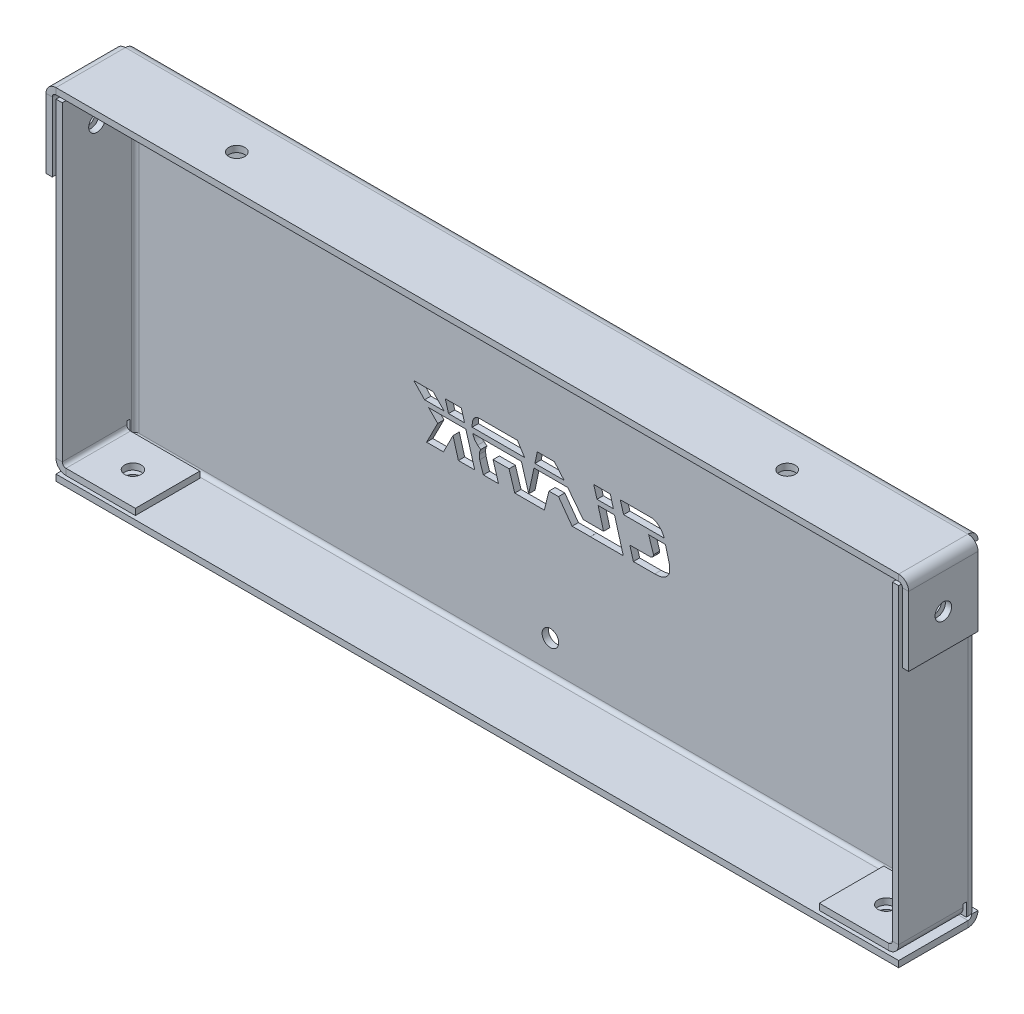
from build123d import *

# Parameters (mm, degrees)
SKETCH1_W                        = 173
SKETCH1_H                        = 70
BASE_FLANGE1_DEPTH               = 1.29
EDGE_FLANGE1_STRIP_W             = 6.684
EDGE_FLANGE1_STRIP_H             = 1.29
EDGE_FLANGE1_STRIP_CUT_DEPTH     = 173
EDGE_FLANGE1_DEPTH               = 173
EDGE_FLANGE2_STRIP_W             = 6.684
EDGE_FLANGE2_STRIP_H             = 1.29
EDGE_FLANGE2_STRIP_CUT_DEPTH     = 173
EDGE_FLANGE2_DEPTH               = 173
EDGE_FLANGE3_STRIP_W             = 6.684
EDGE_FLANGE3_STRIP_H             = 1.29
EDGE_FLANGE3_STRIP_CUT_DEPTH     = 65.896
EDGE_FLANGE3_DEPTH               = 65.896
EDGE_FLANGE4_STRIP_W             = 6.684
EDGE_FLANGE4_STRIP_H             = 1.29
EDGE_FLANGE4_STRIP_CUT_DEPTH     = 65.896
EDGE_FLANGE4_DEPTH               = 65.896
EDGE_FLANGE6_START               = 1.117
EDGE_FLANGE6_DEPTH               = 13.883
EDGE_FLANGE6_2_DEPTH             = 0.645
EDGE_FLANGE6_START_2             = 1.762
EDGE_FLANGE6_3_DEPTH             = 13.238
EDGE_FLANGE8_START               = 1.117
EDGE_FLANGE8_DEPTH               = 13.883
EDGE_FLANGE8_2_DEPTH             = 0.645
EDGE_FLANGE8_START_2             = 1.762
EDGE_FLANGE8_3_DEPTH             = 13.238
M3_CLEARANCE_HOLE3_D             = 3.4
EDGE_FLANGE9_DEPTH               = 14.238
EDGE_FLANGE10_DEPTH              = 14.238
CUT_EXTRUDE2_DEPTH               = 1.29
TAP_DRILL_FOR_M4X0_7_TAP1_REACH  = 191.125
TAP_DRILL_FOR_M4X0_7_TAP1_BORE_R = 1.65
M3_CLEARANCE_HOLE5_D             = 3.4
M3_CLEARANCE_HOLE5_DEPTH         = 3.342
M3_CLEARANCE_HOLE6_D             = 3.4


# Read off the part's stored shape, not the designer's step: Edge-Flange6, Edge-Flange8
# Sheet-metal steps are written as plain solids
with BuildPart() as part:
    # Sketch1 → Base-Flange1 (new body)
    with BuildSketch(Plane.XY):
        with Locations((86.5, 35)):
            Rectangle(SKETCH1_W, SKETCH1_H)
    extrude(amount=-BASE_FLANGE1_DEPTH)

    # Edge-Flange1 strip (across the edge) → Edge-Flange1 strip cut (cut)
    with BuildSketch(Plane(origin=(173, 70, 0), x_dir=(0, -1, 0), z_dir=(-1, 0, 0))):
        with Locations((-1.29, -0.645)):
            Rectangle(EDGE_FLANGE1_STRIP_W, EDGE_FLANGE1_STRIP_H)
    extrude(amount=EDGE_FLANGE1_STRIP_CUT_DEPTH, mode=Mode.SUBTRACT)

    # Edge-Flange1 section (across the edge) → Edge-Flange1 (add)
    with BuildSketch(Plane(origin=(173, 70, 0), x_dir=(0, -1, 0), z_dir=(-1, 0, 0))):
        with BuildLine():
            Line((0, 0.762), (0, 15))
            Line((0, 15), (1.29, 15))
            Line((1.29, 15), (1.29, 0.762))
            ThreePointArc((1.29, 0.762), (1.513184633, 0.223184633), (2.052, 0))
            Line((2.052, 0), (2.052, -1.29))
            ThreePointArc((2.052, -1.29), (0.601016885, -0.688983115), (0, 0.762))
        make_face()
    extrude(amount=EDGE_FLANGE1_DEPTH)

    # Edge-Flange2 strip (across the edge) → Edge-Flange2 strip cut (cut)
    with BuildSketch(Plane.YZ):
        with Locations((-1.29, -0.645)):
            Rectangle(EDGE_FLANGE2_STRIP_W, EDGE_FLANGE2_STRIP_H)
    extrude(amount=EDGE_FLANGE2_STRIP_CUT_DEPTH, mode=Mode.SUBTRACT)

    # Edge-Flange2 section (across the edge) → Edge-Flange2 (add)
    with BuildSketch(Plane.YZ):
        with BuildLine():
            Line((0, 0.762), (0, 15))
            Line((0, 15), (1.29, 15))
            Line((1.29, 15), (1.29, 0.762))
            ThreePointArc((1.29, 0.762), (1.513184633, 0.223184633), (2.052, 0))
            Line((2.052, 0), (2.052, -1.29))
            ThreePointArc((2.052, -1.29), (0.601016885, -0.688983115), (0, 0.762))
        make_face()
    extrude(amount=EDGE_FLANGE2_DEPTH)

    # Edge-Flange3 strip (across the edge) → Edge-Flange3 strip cut (cut)
    with BuildSketch(Plane.XZ.offset(-67.948)):
        with Locations((-1.29, -0.645)):
            Rectangle(EDGE_FLANGE3_STRIP_W, EDGE_FLANGE3_STRIP_H)
    extrude(amount=EDGE_FLANGE3_STRIP_CUT_DEPTH, mode=Mode.SUBTRACT)

    # Edge-Flange3 section (across the edge) → Edge-Flange3 (add)
    with BuildSketch(Plane.XZ.offset(-67.948)):
        with BuildLine():
            Line((0, 0.762), (0, 15))
            Line((0, 15), (1.29, 15))
            Line((1.29, 15), (1.29, 0.762))
            ThreePointArc((1.29, 0.762), (1.513184633, 0.223184633), (2.052, 0))
            Line((2.052, 0), (2.052, -1.29))
            ThreePointArc((2.052, -1.29), (0.601016885, -0.688983115), (0, 0.762))
        make_face()
    extrude(amount=EDGE_FLANGE3_DEPTH)

    # Edge-Flange4 strip (across the edge) → Edge-Flange4 strip cut (cut)
    with BuildSketch(Plane(origin=(173, 2.052, 0), x_dir=(-1, 0, 0), z_dir=(0, 1, 0))):
        with Locations((-1.29, -0.645)):
            Rectangle(EDGE_FLANGE4_STRIP_W, EDGE_FLANGE4_STRIP_H)
    extrude(amount=EDGE_FLANGE4_STRIP_CUT_DEPTH, mode=Mode.SUBTRACT)

    # Edge-Flange4 section (across the edge) → Edge-Flange4 (add)
    with BuildSketch(Plane(origin=(173, 2.052, 0), x_dir=(-1, 0, 0), z_dir=(0, 1, 0))):
        with BuildLine():
            Line((0, 0.762), (0, 15))
            Line((0, 15), (1.29, 15))
            Line((1.29, 15), (1.29, 0.762))
            ThreePointArc((1.29, 0.762), (1.513184633, 0.223184633), (2.052, 0))
            Line((2.052, 0), (2.052, -1.29))
            ThreePointArc((2.052, -1.29), (0.601016885, -0.688983115), (0, 0.762))
        make_face()
    extrude(amount=EDGE_FLANGE4_DEPTH)

    # Edge-Flange6 outline → Edge-Flange6 (cut)
    with BuildSketch(Plane.XY.offset(EDGE_FLANGE6_START)):
        with BuildLine():
            Line((1.29, 2.052), (1.29, 2.198728366))
            ThreePointArc((1.29, 2.198728366), (0.352834322, 2.953547915), (0, 4.104))
            Line((0, 4.104), (0, 2.052))
            Line((0, 2.052), (1.29, 2.052))
        make_face()
    extrude(amount=EDGE_FLANGE6_DEPTH, mode=Mode.SUBTRACT)

    # Edge-Flange6 2 outline → Edge-Flange6 2 (cut)
    with BuildSketch(Plane.XY.offset(EDGE_FLANGE6_START)):
        with BuildLine():
            ThreePointArc((0, 4.104), (0.352834322, 2.953547915), (1.29, 2.198728366))
            Line((1.29, 2.198728366), (1.29, 4.749))
            Line((1.29, 4.749), (0, 4.749))
            Line((0, 4.749), (0, 4.104))
        make_face()
    extrude(amount=EDGE_FLANGE6_2_DEPTH, mode=Mode.SUBTRACT)

    # Edge-Flange6 3 outline → Edge-Flange6 3 (add)
    with BuildSketch(Plane.XY.offset(EDGE_FLANGE6_START_2)):
        with BuildLine():
            Line((2.052, 2.052), (16.29, 2.052))
            Line((16.29, 2.052), (16.29, 3.342))
            Line((16.29, 3.342), (2.052, 3.342))
            ThreePointArc((2.052, 3.342), (1.513184633, 3.565184633), (1.29, 4.104))
            Line((1.29, 4.104), (1.29, 2.198728366))
            ThreePointArc((1.29, 2.198728366), (1.664000898, 2.089015956), (2.052, 2.052))
        make_face()
    extrude(amount=EDGE_FLANGE6_3_DEPTH)

    # Edge-Flange8 outline → Edge-Flange8 (cut)
    with BuildSketch(Plane.XY.offset(EDGE_FLANGE8_START)):
        with BuildLine():
            ThreePointArc((173, 4.104), (172.647165678, 2.953547915), (171.71, 2.198728366))
            Line((171.71, 2.198728366), (171.71, 2.052))
            Line((171.71, 2.052), (173, 2.052))
            Line((173, 2.052), (173, 4.104))
        make_face()
    extrude(amount=EDGE_FLANGE8_DEPTH, mode=Mode.SUBTRACT)

    # Edge-Flange8 2 outline → Edge-Flange8 2 (cut)
    with BuildSketch(Plane.XY.offset(EDGE_FLANGE8_START)):
        with BuildLine():
            Line((171.71, 4.749), (171.71, 2.198728366))
            ThreePointArc((171.71, 2.198728366), (172.647165678, 2.953547915), (173, 4.104))
            Line((173, 4.104), (173, 4.749))
            Line((173, 4.749), (171.71, 4.749))
        make_face()
    extrude(amount=EDGE_FLANGE8_2_DEPTH, mode=Mode.SUBTRACT)

    # Edge-Flange8 3 outline → Edge-Flange8 3 (add)
    with BuildSketch(Plane.XY.offset(EDGE_FLANGE8_START_2)):
        with BuildLine():
            Line((156.71, 3.342), (156.71, 2.052))
            Line((156.71, 2.052), (170.948, 2.052))
            ThreePointArc((170.948, 2.052), (171.335999102, 2.089015956), (171.71, 2.198728366))
            Line((171.71, 2.198728366), (171.71, 4.104))
            ThreePointArc((171.71, 4.104), (171.486815367, 3.565184633), (170.948, 3.342))
            Line((170.948, 3.342), (156.71, 3.342))
        make_face()
    extrude(amount=EDGE_FLANGE8_3_DEPTH)

    # M3 Clearance Hole3 (through all)
    with Locations(Plane(origin=(122.233939387, 19.783275694, -1.29), x_dir=(-1, 0, 0), z_dir=(0, 0, -1))):
        with Locations((35.733939387, -11.902275694)):
            Hole(M3_CLEARANCE_HOLE3_D / 2)

    # Edge-Flange9 section (across the edge) → Edge-Flange9 (add)
    with BuildSketch(Plane(origin=(173.762, 68.71, 0.762), x_dir=(-1, 0, 0), z_dir=(0, 0, 1))):
        with BuildLine():
            Line((-1.29, 0.762), (-1.29, 15))
            Line((-1.29, 15), (0, 15))
            Line((0, 15), (0, 0.762))
            ThreePointArc((0, 0.762), (0.223184633, 0.223184633), (0.762, 0))
            Line((0.762, 0), (0.762, -1.29))
            ThreePointArc((0.762, -1.29), (-0.688983115, -0.688983115), (-1.29, 0.762))
        make_face()
    extrude(amount=EDGE_FLANGE9_DEPTH)

    # Edge-Flange10 section (across the edge) → Edge-Flange10 (add)
    with BuildSketch(Plane(origin=(-0.762, 68.71, 15), x_dir=(1, 0, 0), z_dir=(0, 0, -1))):
        with BuildLine():
            Line((-1.29, 0.762), (-1.29, 15))
            Line((-1.29, 15), (0, 15))
            Line((0, 15), (0, 0.762))
            ThreePointArc((0, 0.762), (0.223184633, 0.223184633), (0.762, 0))
            Line((0.762, 0), (0.762, -1.29))
            ThreePointArc((0.762, -1.29), (-0.688983115, -0.688983115), (-1.29, 0.762))
        make_face()
    extrude(amount=EDGE_FLANGE10_DEPTH)

    # Sketch46 → Cut-Extrude2 (cut)
    with BuildSketch(Plane(origin=(0, 0, -1.29), x_dir=(-1, 0, 0), z_dir=(0, 0, -1))):
        with BuildLine():
            Line((-100.843859741, 39.649023437), (-101.529342448, 37.333257813))
            Line((-101.529342448, 37.333257813), (-109.845594523, 37.333257813))
            add(Edge.make_bspline(
                [(-109.845594523, 37.333257813), (-109.823359716, 37.4040619), (-109.778887379, 37.545678746), (-109.690317685, 37.749926004), (-109.592478041, 37.951106926), (-109.476552061, 38.145097035), (-109.35061131, 38.336725113), (-109.209411005, 38.522532668), (-109.051937151, 38.700953385), (-108.939519771, 38.81529249), (-108.882702393, 38.873081136)],
                knots=[0, 0, 0, 0, 0.969584053, 1.939286824, 2.906969419, 3.892567764, 4.891161531, 5.903872825, 6.940586855, 8, 8, 8, 8], degree=3))
            add(Edge.make_bspline(
                [(-108.882702393, 38.873081136), (-108.81717706, 38.934298604), (-108.689238453, 39.053826079), (-108.488639993, 39.213325628), (-108.283585522, 39.347022128), (-108.078165507, 39.457623209), (-107.870220426, 39.543983454), (-107.660487256, 39.604095076), (-107.44811619, 39.642068698), (-107.30550953, 39.646707823), (-107.234327555, 39.649023437)],
                knots=[0, 0, 0, 0, 1.151042241, 2.247416924, 3.285395898, 4.289929018, 5.238920285, 6.170118847, 7.086616619, 8, 8, 8, 8], degree=3))
            Line((-107.234327555, 39.649023437), (-100.843859741, 39.649023437))
        make_face()
        with BuildLine():
            Line((-102.81185848, 32.573072917), (-103.537545451, 30))
            Line((-103.537545451, 30), (-107.939912394, 30))
            add(Edge.make_bspline(
                [(-107.939912394, 30), (-108.033065625, 30.001365553), (-108.215491393, 30.00403977), (-108.482709464, 30.018833902), (-108.736781189, 30.050007527), (-108.978231232, 30.090152839), (-109.207948208, 30.138624302), (-109.422860578, 30.20414092), (-109.62558508, 30.277870086), (-109.814470824, 30.365096799), (-109.992350841, 30.460569285), (-110.155978955, 30.570309921), (-110.307512715, 30.690434216), (-110.444127887, 30.824330419), (-110.569926505, 30.967592749), (-110.682758023, 31.122698939), (-110.781831205, 31.289634519), (-110.835681255, 31.40795324), (-110.86276241, 31.467455648)],
                knots=[0, 0, 0, 0, 1.285130438, 2.516723288, 3.689614434, 4.814121375, 5.892908561, 6.925234272, 7.910815483, 8.866288762, 9.792843532, 10.692686491, 11.58048512, 12.456415222, 13.327699743, 14.207765629, 15.098686514, 16, 16, 16, 16], degree=3))
            add(Edge.make_bspline(
                [(-110.86276241, 31.467455648), (-110.891367426, 31.547193687), (-110.952620804, 31.717940812), (-110.996316857, 32.006582876), (-111.009613318, 32.336032485), (-110.993781477, 32.568429153), (-110.985385417, 32.691675496)],
                knots=[0, 0, 0, 0, 0.817267469, 1.750056471, 2.806793075, 4, 4, 4, 4], degree=3))
            add(Edge.make_bspline(
                [(-110.985385417, 32.691675496), (-110.981912026, 32.722485911), (-110.973762779, 32.79477311), (-110.963332747, 32.91838193), (-110.943158292, 33.072124724), (-110.931474262, 33.184813993), (-110.92507902, 33.246494344)],
                knots=[0, 0, 0, 0, 0.666647788, 1.56408479, 2.666704423, 4, 4, 4, 4], degree=3))
            Line((-110.92507902, 33.246494344), (-110.116973307, 36.330161418))
            Line((-110.116973307, 36.330161418), (-106.671467855, 36.35026355))
            Line((-106.671467855, 36.35026355), (-107.66853361, 33.278657756))
            add(Edge.make_bspline(
                [(-107.66853361, 33.278657756), (-107.652803846, 33.21775819), (-107.621423073, 33.096263974), (-107.593840769, 32.973851551), (-107.580084229, 32.91279895)],
                knots=[0, 0, 0, 0, 1.002509712, 2, 2, 2, 2], degree=3))
            add(Edge.make_bspline(
                [(-107.580084229, 32.91279895), (-107.555383758, 32.871572646), (-107.505125097, 32.787688465), (-107.386367139, 32.689928144), (-107.237198867, 32.617163033), (-107.1251545, 32.58839653), (-107.065469645, 32.573072917)],
                knots=[0, 0, 0, 0, 0.898606002, 1.828415905, 2.843220022, 4, 4, 4, 4], degree=3))
            Line((-107.065469645, 32.573072917), (-102.81185848, 32.573072917))
        make_face()
        Polygon((-95.386130859, 39.649023437), (-96.071613566, 37.333257813), (-99.43671049, 37.333257813), (-98.7994729, 39.628921305), align=None)
        Polygon((-92.768833252, 32.315765625), (-94.708689006, 30), (-101.465015625, 30), (-99.673915649, 36.35026355), (-96.302788086, 36.35026355), (-97.416446208, 32.315765625), align=None)
        Polygon((-83.31681071, 37.333257813), (-89.313276733, 37.333257813), (-87.319145223, 39.649023437), (-83.811323161, 39.649023437), align=None)
        Polygon((-81.768946533, 30), (-85.256666463, 30), (-86.199456462, 33.859609375), (-88.1674552, 33.859609375), (-90.961651571, 30), (-95.032333333, 30.00603064), (-90.059065837, 36.432682292), (-83.125840454, 36.432682292), align=None)
        with BuildLine():
            Line((-70.435364421, 37.333257813), (-81.204076619, 37.333257813))
            Line((-81.204076619, 37.333257813), (-79.732600545, 39.649023437))
            Line((-79.732600545, 39.649023437), (-71.826431966, 39.649023437))
            add(Edge.make_bspline(
                [(-71.826431966, 39.649023437), (-71.772506654, 39.646408147), (-71.662219266, 39.641059386), (-71.497400666, 39.592379518), (-71.329619301, 39.521041285), (-71.223810846, 39.453023935), (-71.169092244, 39.417848918)],
                knots=[0, 0, 0, 0, 0.913581768, 1.868446239, 2.897671833, 4, 4, 4, 4], degree=3))
            add(Edge.make_bspline(
                [(-71.169092244, 39.417848918), (-71.117876028, 39.380828434), (-71.017821837, 39.308506526), (-70.886822589, 39.182353434), (-70.773825171, 39.047639071), (-70.715501045, 38.948346102), (-70.686641073, 38.899213908)],
                knots=[0, 0, 0, 0, 1.059583365, 2.069964611, 3.044978977, 4, 4, 4, 4], degree=3))
            add(Edge.make_bspline(
                [(-70.686641073, 38.899213908), (-70.666417138, 38.858016617), (-70.623296796, 38.770178057), (-70.572229737, 38.62391232), (-70.531052642, 38.456709229), (-70.494266621, 38.271088543), (-70.46995435, 38.064670009), (-70.449196869, 37.838845157), (-70.437559592, 37.592695684), (-70.436112906, 37.421718049), (-70.435364421, 37.333257813)],
                knots=[0, 0, 0, 0, 0.68813208, 1.467196756, 2.318188026, 3.270514463, 4.304265893, 5.434736438, 6.672786523, 8, 8, 8, 8], degree=3))
        make_face()
        with BuildLine():
            add(Edge.make_bspline(
                [(-70.598191691, 36.304028646), (-70.609943908, 36.233963791), (-70.633664817, 36.092543497), (-70.700074699, 35.885482573), (-70.786692512, 35.681480785), (-70.896491242, 35.480884515), (-71.030109523, 35.283366691), (-71.187465518, 35.089085383), (-71.366604352, 34.896561058), (-71.500430683, 34.77721921), (-71.569124674, 34.715960205)],
                knots=[0, 0, 0, 0, 0.89522961, 1.806949233, 2.734865869, 3.688117976, 4.686871091, 5.73903451, 6.839430601, 8, 8, 8, 8], degree=3))
            add(Edge.make_bspline(
                [(-71.569124674, 34.715960205), (-71.632158936, 34.662895638), (-71.749145876, 34.564411718), (-71.921370164, 34.43850495), (-72.074062209, 34.341320358), (-72.17500455, 34.297469051), (-72.220433757, 34.277733724)],
                knots=[0, 0, 0, 0, 1.253750942, 2.326869253, 3.247005745, 4, 4, 4, 4], degree=3))
            add(Edge.make_bspline(
                [(-72.220433757, 34.277733724), (-72.170855924, 34.195308794), (-72.074171284, 34.034567103), (-71.97591328, 33.773351686), (-71.912377696, 33.507545862), (-71.904656322, 33.326588627), (-71.900809855, 33.236443278)],
                knots=[0, 0, 0, 0, 1.043583065, 2.035152543, 3.021194923, 4, 4, 4, 4], degree=3))
            add(Edge.make_bspline(
                [(-71.900809855, 33.236443278), (-71.902160124, 33.177439793), (-71.905126478, 33.047817301), (-71.925468376, 32.838112543), (-71.952520786, 32.59514805), (-71.980396432, 32.423536316), (-71.995289876, 32.331847331)],
                knots=[0, 0, 0, 0, 0.77775057, 1.708610381, 2.775752775, 4, 4, 4, 4], degree=3))
            add(Edge.make_bspline(
                [(-71.995289876, 32.331847331), (-72.002922735, 32.292889646), (-72.02162131, 32.197453159), (-72.067712001, 32.031538109), (-72.133197204, 31.815661726), (-72.214976941, 31.549420919), (-72.316115447, 31.232452379), (-72.436710816, 30.866128535), (-72.575309556, 30.449077604), (-72.675837086, 30.155373828), (-72.7290177, 30)],
                knots=[0, 0, 0, 0, 0.389472445, 0.95410909, 1.688508646, 2.603699675, 3.68718707, 4.953583, 6.388398418, 8, 8, 8, 8], degree=3))
            Line((-72.7290177, 30), (-75.842837972, 30))
            Line((-75.842837972, 30), (-74.731190063, 33.730955729))
            Line((-74.731190063, 33.730955729), (-78.007837606, 33.730955729))
            Line((-78.007837606, 33.730955729), (-79.187832764, 30))
            Line((-79.187832764, 30), (-82.424276042, 30))
            Line((-82.424276042, 30), (-80.558798177, 36.304028646))
            Line((-80.558798177, 36.304028646), (-70.598191691, 36.304028646))
        make_face()
        Polygon((-58.448463013, 39.649023437), (-60.667738403, 37.333257813), (-64.690175049, 37.333257813), (-62.430695394, 39.649023437), align=None)
        Polygon((-64.921349569, 39.649023437), (-65.586730143, 37.333257813), (-68.883479818, 37.333257813), (-68.218099243, 39.649023437), align=None)
        Polygon((-61.075811686, 30), (-64.543429484, 30), (-66.50338737, 33.88172172), (-67.615035278, 30), (-70.974101562, 30), (-69.142797323, 36.35026355), (-61.510017741, 36.35026355), (-63.367454753, 34.472724406), align=None)
    extrude(amount=-CUT_EXTRUDE2_DEPTH, mode=Mode.SUBTRACT)

    # Tap Drill for M4x0.7 Tap1 bore → Tap Drill for M4x0.7 Tap1 (cut, up to next)
    with BuildSketch(Plane(origin=(0, 70, 0), x_dir=(1, 0, 0), z_dir=(0, 1, 0)), mode=Mode.PRIVATE) as tap_drill_for_m4x0_7_tap1_sk1:
        with Locations((30, -7.881)):
            Circle(TAP_DRILL_FOR_M4X0_7_TAP1_BORE_R)
    tap_drill_for_m4x0_7_tap1_tool1 = extrude(tap_drill_for_m4x0_7_tap1_sk1.sketch, amount=-TAP_DRILL_FOR_M4X0_7_TAP1_REACH, mode=Mode.PRIVATE) & part.part
    # Tap Drill for M4x0.7 Tap1 bore → Tap Drill for M4x0.7 Tap1 (cut, up to next)
    with BuildSketch(Plane(origin=(0, 70, 0), x_dir=(1, 0, 0), z_dir=(0, 1, 0)), mode=Mode.PRIVATE) as tap_drill_for_m4x0_7_tap1_sk2:
        with Locations((143, -7.881)):
            Circle(TAP_DRILL_FOR_M4X0_7_TAP1_BORE_R)
    tap_drill_for_m4x0_7_tap1_tool2 = extrude(tap_drill_for_m4x0_7_tap1_sk2.sketch, amount=-TAP_DRILL_FOR_M4X0_7_TAP1_REACH, mode=Mode.PRIVATE) & part.part
    add(tap_drill_for_m4x0_7_tap1_tool1.solids().sort_by_distance((30, 70, 7.881))[0], mode=Mode.SUBTRACT)
    add(tap_drill_for_m4x0_7_tap1_tool2.solids().sort_by_distance((143, 70, 7.881))[0], mode=Mode.SUBTRACT)

    # M3 Clearance Hole5
    with Locations(Plane(origin=(0, 3.342, 0), x_dir=(1, 0, 0), z_dir=(0, 1, 0))):
        with Locations((9.171, -8.381), (163.829, -8.381)):
            Hole(M3_CLEARANCE_HOLE5_D / 2, depth=M3_CLEARANCE_HOLE5_DEPTH)

    # M3 Clearance Hole6 (through all)
    with Locations(Plane(origin=(175.052, 0, 0), x_dir=(0, 0, -1), z_dir=(1, 0, 0))):
        with Locations((-7.881, 60.829)):
            Hole(M3_CLEARANCE_HOLE6_D / 2)


solid = part.part
